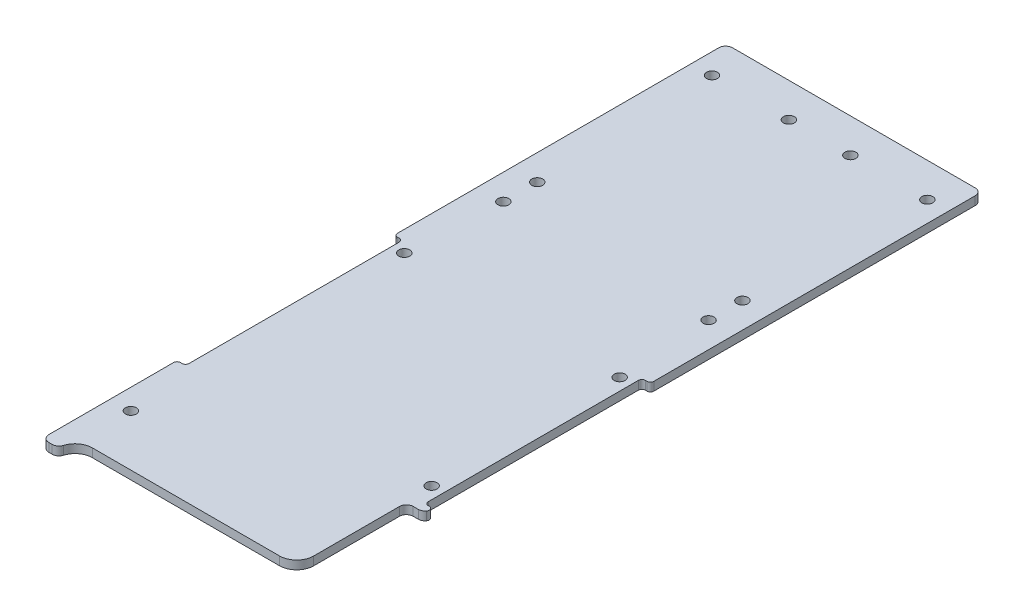
from build123d import *

# Parameters (mm, degrees)
SKETCH1_R               = 2.032
BOSS_EXTRUDE1_DEPTH     = 3.175
FILLET1_R               = 2.54
FILLET2_R               = 2.54
FILLET3_R               = 6.35
CUT_EXTRUDE1_DEPTH      = 136.673215063
FILLET4_R               = 6.35
FILLET5_R               = 2.54
SKETCH3_R               = 2.032
CUT_EXTRUDE2_DEPTH      = 136.673215063
CUT_EXTRUDE3_DEPTH      = 136.673215063
CUT_EXTRUDE3_DEPTH_BACK = 136.673215063
SKETCH4_W               = 3.175
SKETCH4_H               = 80.645
FILLET6_R               = 1.27


with BuildPart() as part:
    # Sketch1 → Boss-Extrude1 (new body)
    with BuildSketch(Plane(origin=(0, 0, 0), x_dir=(1, 0, 0), z_dir=(0, 1, 0))):
        Polygon((47.625, 127), (-47.625, 127), (-47.625, -127), (-41.275, -127), (-41.275, -120.65), (41.275, -120.65), (41.275, -127), (47.625, -127), align=None)
        with Locations((-39.999684148, -101.6)):
            Circle(SKETCH1_R, mode=Mode.SUBTRACT)
        with Locations((39.999684148, -69.85)):
            Circle(SKETCH1_R, mode=Mode.SUBTRACT)
        with Locations((-39.999684148, 0)):
            Circle(SKETCH1_R, mode=Mode.SUBTRACT)
        with Locations((-39.999684148, 114.3)):
            Circle(SKETCH1_R, mode=Mode.SUBTRACT)
        with Locations((-11.424684148, 114.3)):
            Circle(SKETCH1_R, mode=Mode.SUBTRACT)
        with Locations((39.999684148, 0)):
            Circle(SKETCH1_R, mode=Mode.SUBTRACT)
        with Locations((11.424684148, 114.3)):
            Circle(SKETCH1_R, mode=Mode.SUBTRACT)
        with Locations((39.999684148, 114.3)):
            Circle(SKETCH1_R, mode=Mode.SUBTRACT)
    extrude(amount=BOSS_EXTRUDE1_DEPTH)

    # Fillet1
    fillet1_edges = [part.edges().sort_by_distance(p)[0] for p in [
        (-47.625, 1.5875, -127),
        (47.625, 1.5875, -127),
        (47.625, 1.5875, 127),
        (-47.625, 1.5875, 127),
    ]]
    fillet(fillet1_edges, radius=FILLET1_R)

    # Fillet2
    fillet2_edges = [part.edges().sort_by_distance(p)[0] for p in [
        (41.275, 1.5875, 127),
        (-41.275, 1.5875, 127),
    ]]
    fillet(fillet2_edges, radius=FILLET2_R)

    # Fillet3
    fillet3_edges = [part.edges().sort_by_distance(p)[0] for p in [
        (41.275, 1.5875, 120.65),
        (-41.275, 1.5875, 120.65),
    ]]
    fillet(fillet3_edges, radius=FILLET3_R)

    # Sketch2 → Cut-Extrude1 (cut, through all)
    with BuildSketch(Plane.XZ):
        with BuildLine():
            Line((40.64508, 123.578690235), (40.64508, 79.88808))
            Line((40.64508, 79.88808), (47.625, 79.88808))
            Line((47.625, 79.88808), (47.625, 124.46))
            ThreePointArc((47.625, 124.46), (46.881051224, 126.256051224), (45.085, 127))
            Line((45.085, 127), (43.815, 127))
            ThreePointArc((43.815, 127), (42.297059666, 126.496530663), (41.380880287, 125.185714286))
            ThreePointArc((41.380880287, 125.185714286), (41.069166069, 124.356476684), (40.64508, 123.578690235))
        make_face()
    extrude(amount=-CUT_EXTRUDE1_DEPTH, mode=Mode.SUBTRACT)

    # Fillet4
    fillet4_edges = [part.edges().sort_by_distance(p)[0] for p in [
        (40.64508, 1.5875, 123.578690235),
    ]]
    fillet(fillet4_edges, radius=FILLET4_R)

    # Fillet5
    fillet5_edges = [part.edges().sort_by_distance(p)[0] for p in [
        (47.625, 1.5875, 79.88808),
        (40.64508, 1.5875, 79.88808),
    ]]
    fillet(fillet5_edges, radius=FILLET5_R)

    # Sketch3 → Cut-Extrude2 (cut, through all)
    with BuildSketch(Plane.XZ):
        with Locations((-38.109906469, -34.913768806)):
            Circle(SKETCH3_R)
        with Locations((-38.109906469, -47.490173279)):
            Circle(SKETCH3_R)
        with Locations((38.109906469, -47.490173279)):
            Circle(SKETCH3_R)
        with Locations((38.109906469, -34.913768806)):
            Circle(SKETCH3_R)
    extrude(amount=-CUT_EXTRUDE2_DEPTH, mode=Mode.SUBTRACT)

    # Sketch4 → Cut-Extrude3 (cut, two sides: drawn at the far end of the back side and taken through both)
    with BuildSketch(Plane(origin=(0, 3.175, 0), x_dir=(1, 0, 0), z_dir=(0, 1, 0)).offset(-CUT_EXTRUDE3_DEPTH_BACK)):
        with Locations((-46.0375, -36.5125)):
            Rectangle(SKETCH4_W, SKETCH4_H)
        with Locations((46.0375, -36.5125)):
            Rectangle(SKETCH4_W, SKETCH4_H)
    extrude(amount=CUT_EXTRUDE3_DEPTH + CUT_EXTRUDE3_DEPTH_BACK, mode=Mode.SUBTRACT)

    # Fillet6
    fillet6_edges = [part.edges().sort_by_distance(p)[0] for p in [
        (-44.45, 1.5875, -3.81),
        (-47.625, 1.5875, -3.81),
        (-47.625, 1.5875, 76.835),
        (-44.45, 1.5875, 76.835),
        (44.45, 1.5875, 76.835),
        (47.625, 1.5875, 76.835),
        (44.45, 1.5875, -3.81),
        (47.625, 1.5875, -3.81),
    ]]
    fillet(fillet6_edges, radius=FILLET6_R)


solid = part.part
